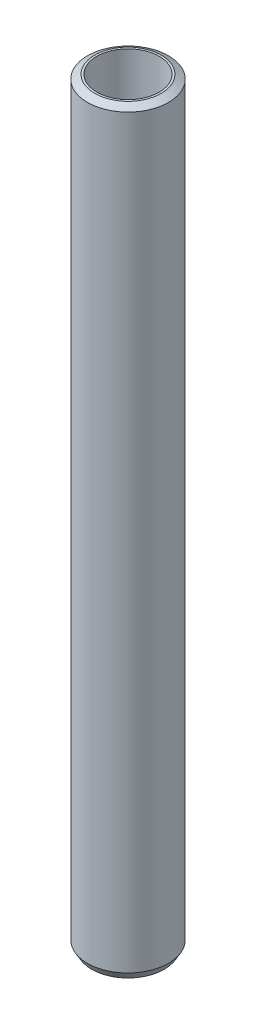
from build123d import *
from OCP.BRepFilletAPI import BRepFilletAPI_MakeChamfer

# Parameters (mm, degrees)
SKETCH1_R           = 17.5
BOSS_EXTRUDE1_DEPTH = 327.097514476
SKETCH2_R           = 13.467184489
CUT_EXTRUDE1_DEPTH  = 329.032443481
CHAMFER1_SIZE       = 1.813566578
CHAMFER1_SIZE2      = 3.141189456


with BuildPart() as part:
    # Sketch1 → Boss-Extrude1 (new body)
    with BuildSketch(Plane(origin=(0, 0, 0), x_dir=(1, 0, 0), z_dir=(0, 1, 0))):
        Circle(SKETCH1_R)
    extrude(amount=BOSS_EXTRUDE1_DEPTH)

    # Sketch2 → Cut-Extrude1 (cut, through all)
    with BuildSketch(Plane(origin=(0, 0, 0), x_dir=(1, 0, 0), z_dir=(0, 1, 0))):
        Circle(SKETCH2_R)
    extrude(amount=CUT_EXTRUDE1_DEPTH, mode=Mode.SUBTRACT)

    # Chamfer1: one chamfer whose edges measure the first distance from different faces: ONE call of the kernel's chamfer builder (chamfer() names one face for all edges)
    chamfer1_edges_1 = [part.edges().sort_by_distance(p)[0] for p in [
        (-17.5, 327.097514476, 0),
    ]]
    chamfer1_side_1 = [part.faces().sort_by_distance(p)[0] for p in [
        (-17.5, 163.548757238, 0),
    ]]
    chamfer1_edges_2 = [part.edges().sort_by_distance(p)[0] for p in [
        (-17.5, 0, 0),
    ]]
    chamfer1_side_2 = [part.faces().sort_by_distance(p)[0] for p in [
        (-17.005025253, 0, 0),
    ]]
    chamfer1 = BRepFilletAPI_MakeChamfer(part.part.solid().wrapped)
    for e in chamfer1_edges_1:
        chamfer1.Add(CHAMFER1_SIZE, CHAMFER1_SIZE2, e.wrapped, chamfer1_side_1[0].wrapped)  # the first distance lies on this face
    for e in chamfer1_edges_2:
        chamfer1.Add(CHAMFER1_SIZE, CHAMFER1_SIZE2, e.wrapped, chamfer1_side_2[0].wrapped)  # the first distance lies on this face
    add(Compound.cast(chamfer1.Shape()), mode=Mode.REPLACE)


solid = part.part
